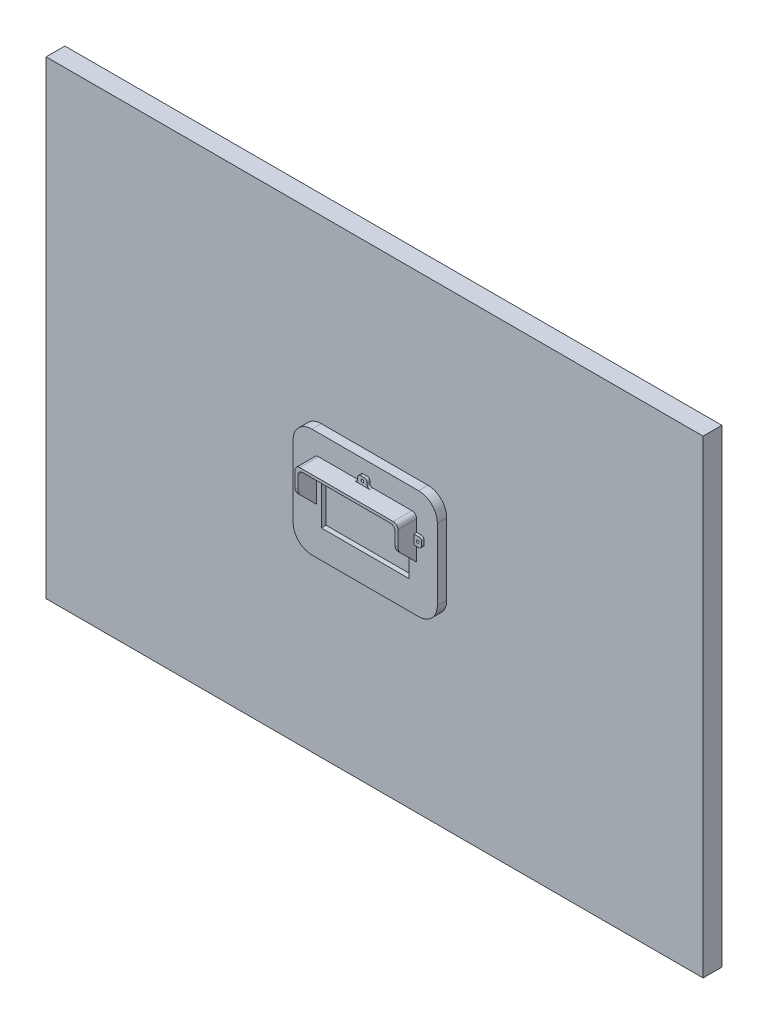
from build123d import *

# Parameters (mm, degrees)
ESBO_O2_W                = 20
ESBO_O2_H                = 500
RESSALTO_EXTRUS_O1_DEPTH = 700
ESBO_O3_W                = 93.65
ESBO_O3_H                = 56.193
RESSALTO_EXTRUS_O2_DEPTH = 5
ESBO_O5_W                = 93.65
ESBO_O5_H                = 56.193
RESSALTO_EXTRUS_O3_DEPTH = 10
RESSALTO_EXTRUS_O4_DEPTH = 20
CORTE_EXTRUS_O1_DEPTH    = 116
FILETE1_R                = 10
ESBO_O8_W                = 3
ESBO_O8_H                = 10
RESSALTO_EXTRUS_O5_DEPTH = 8
FILETE2_R                = 3
ESBO_O9_R                = 1.5
CORTE_EXTRUS_O2_DEPTH    = 8
ESPELHAR1_START          = 5
ESPELHAR1_OUTLINE_R      = 1.5
ESPELHAR1_DEPTH          = 5
ESPELHAR1_START_2        = 10
ESPELHAR1_2_OUTLINE_R    = 1.5
ESPELHAR1_2_DEPTH        = 3
ESBO_O12_W               = 10
ESBO_O12_H               = 3
RESSALTO_EXTRUS_O6_DEPTH = 8
FILETE3_R                = 3
ESBO_O13_R               = 1.5
CORTE_EXTRUS_O3_DEPTH    = 8


# Read off the part's stored shape, not the designer's step: Espelhar1
with BuildPart() as part:
    # Esboço2 → Ressalto-extrusão1 (new body)
    with BuildSketch(Plane(origin=(0, 0, 0), x_dir=(0, 0, -1), z_dir=(1, 0, 0))):
        with Locations((10, 250)):
            Rectangle(ESBO_O2_W, ESBO_O2_H)
    extrude(amount=RESSALTO_EXTRUS_O1_DEPTH)

    # Esboço3 → Ressalto-extrusão2 (add)
    with BuildSketch(Plane.XY):
        with Locations((350, 250)):
            Rectangle(ESBO_O3_W, ESBO_O3_H)
    extrude(amount=RESSALTO_EXTRUS_O2_DEPTH)

    # Esboço5 → Ressalto-extrusão3 (add)
    with BuildSketch(Plane.XY):
        with BuildLine():
            Line((293.175, 191.9035), (406.825, 191.9035))
            ThreePointArc((406.825, 191.9035), (420.967135624, 197.761364376), (426.825, 211.9035))
            Line((426.825, 211.9035), (426.825, 288.0965))
            ThreePointArc((426.825, 288.0965), (420.967135624, 302.238635624), (406.825, 308.0965))
            Line((406.825, 308.0965), (293.175, 308.0965))
            ThreePointArc((293.175, 308.0965), (279.032864376, 302.238635624), (273.175, 288.0965))
            Line((273.175, 288.0965), (273.175, 211.9035))
            ThreePointArc((273.175, 211.9035), (279.032864376, 197.761364376), (293.175, 191.9035))
        make_face()
        with Locations((350, 250)):
            Rectangle(ESBO_O5_W, ESBO_O5_H, mode=Mode.SUBTRACT)
    extrude(amount=RESSALTO_EXTRUS_O3_DEPTH)

    # Esboço6 → Ressalto-extrusão4 (add)
    with BuildSketch(Plane.XY.offset(10)):
        with BuildLine():
            Line((298.175, 241.0965), (298.175, 278.0965))
            ThreePointArc((298.175, 278.0965), (299.639466094, 281.632033906), (303.175, 283.0965))
            Line((303.175, 283.0965), (396.825, 283.0965))
            ThreePointArc((396.825, 283.0965), (400.360533906, 281.632033906), (401.825, 278.0965))
            Line((401.825, 278.0965), (401.825, 241.0965))
            Line((401.825, 241.0965), (404.825, 241.0965))
            Line((404.825, 241.0965), (404.825, 281.0965))
            ThreePointArc((404.825, 281.0965), (403.360533906, 284.632033906), (399.825, 286.0965))
            Line((399.825, 286.0965), (300.175, 286.0965))
            ThreePointArc((300.175, 286.0965), (296.639466094, 284.632033906), (295.175, 281.0965))
            Line((295.175, 281.0965), (295.175, 241.0965))
            Line((295.175, 241.0965), (298.175, 241.0965))
        make_face()
    extrude(amount=RESSALTO_EXTRUS_O4_DEPTH)

    # Esboço7 → Corte-extrusão1 (cut)
    with BuildSketch(Plane(origin=(404.825, 0, 0), x_dir=(0, 0, -1), z_dir=(1, 0, 0))):
        Polygon((-10, 241.0965), (-30, 261.0965), (-30, 241.0965), align=None)
    extrude(amount=-CORTE_EXTRUS_O1_DEPTH, mode=Mode.SUBTRACT)

    # Filete1
    filete1_edges = [part.edges().sort_by_distance(p)[0] for p in [
        (403.325, 261.0965, 30),
        (296.675, 261.0965, 30),
    ]]
    fillet(filete1_edges, radius=FILETE1_R)

    # Esboço8 → Ressalto-extrusão5 (add)
    with BuildSketch(Plane.ZY.offset(-295.175)):
        with Locations((11.5, 263.5965)):
            Rectangle(ESBO_O8_W, ESBO_O8_H)
    extrude(amount=RESSALTO_EXTRUS_O5_DEPTH)

    # Filete2
    filete2_edges = [part.edges().sort_by_distance(p)[0] for p in [
        (295.175, 258.5965, 11.5),
        (295.175, 268.5965, 11.5),
        (287.175, 258.5965, 11.5),
        (287.175, 268.5965, 11.5),
    ]]
    fillet(filete2_edges, radius=FILETE2_R)

    # Esboço9 → Corte-extrusão2 (cut)
    with BuildSketch(Plane.XY.offset(13)):
        with Locations((291.175, 263.5965)):
            Circle(ESBO_O9_R)
    extrude(amount=-CORTE_EXTRUS_O2_DEPTH, mode=Mode.SUBTRACT)

    # Espelhar1 outline → Espelhar1 (cut)
    with BuildSketch(Plane.XY.offset(ESPELHAR1_START)):
        with Locations((408.825, 263.5965)):
            Circle(ESPELHAR1_OUTLINE_R)
    extrude(amount=ESPELHAR1_DEPTH, mode=Mode.SUBTRACT)

    # Espelhar1 2 outline → Espelhar1 2 (add)
    with BuildSketch(Plane.XY.offset(ESPELHAR1_START_2)):
        with BuildLine():
            Line((404.825, 268.5965), (404.825, 258.5965))
            Line((404.825, 258.5965), (409.825, 258.5965))
            ThreePointArc((409.825, 258.5965), (411.946320344, 259.475179656), (412.825, 261.5965))
            Line((412.825, 261.5965), (412.825, 265.5965))
            ThreePointArc((412.825, 265.5965), (411.946320344, 267.717820344), (409.825, 268.5965))
            Line((409.825, 268.5965), (404.825, 268.5965))
        make_face()
        with Locations((408.825, 263.5965)):
            Circle(ESPELHAR1_2_OUTLINE_R, mode=Mode.SUBTRACT)
    extrude(amount=ESPELHAR1_2_DEPTH)

    # Esboço12 → Ressalto-extrusão6 (add)
    with BuildSketch(Plane(origin=(0, 286.0965, 0), x_dir=(1, 0, 0), z_dir=(0, 1, 0))):
        with Locations((350, -11.5)):
            Rectangle(ESBO_O12_W, ESBO_O12_H)
    extrude(amount=RESSALTO_EXTRUS_O6_DEPTH)

    # Filete3
    filete3_edges = [part.edges().sort_by_distance(p)[0] for p in [
        (355, 286.0965, 11.5),
        (345, 286.0965, 11.5),
        (355, 294.0965, 11.5),
        (345, 294.0965, 11.5),
    ]]
    fillet(filete3_edges, radius=FILETE3_R)

    # Esboço13 → Corte-extrusão3 (cut)
    with BuildSketch(Plane.XY.offset(13)):
        with Locations((350, 290.0965)):
            Circle(ESBO_O13_R)
    extrude(amount=-CORTE_EXTRUS_O3_DEPTH, mode=Mode.SUBTRACT)


solid = part.part
